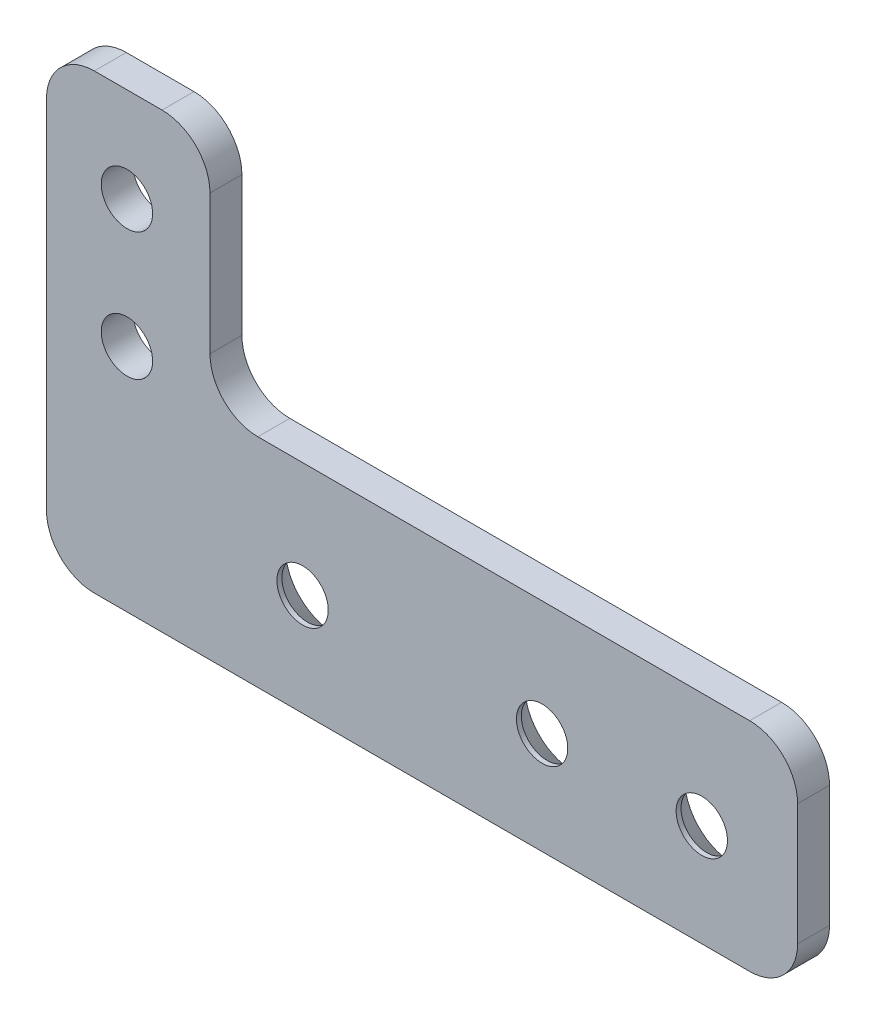
from build123d import *

# Parameters (mm, degrees)
SKETCH1_R                                    = 2.5527
BOSS_EXTRUDE1_DEPTH                          = 3.175
FILLET1_R                                    = 4.7625
CSK_FOR_10_FLAT_HEAD_MACHINE_SCREW3_AT_COUNT = 2
CSK_FOR_10_FLAT_HEAD_MACHINE_SCREW3_AT_PITCH = 15.875
CSK_FOR_10_FLAT_HEAD_MACHINE_SCREW3_2_COUNT  = 2
CSK_FOR_10_FLAT_HEAD_MACHINE_SCREW3_2_PITCH  = 39.6875


with BuildPart() as part:
    # Sketch1 → Boss-Extrude1 (new body)
    with BuildSketch(Plane.XY):
        Polygon((-33.401, 23.749), (-33.401, -21.209), (41.275, -21.209), (41.275, 0.381), (-17.145, 0.381), (-17.145, 23.749), align=None)
        with Locations((-25.4, 1.651)):
            Circle(SKETCH1_R, mode=Mode.SUBTRACT)
        with Locations((-25.4, 14.351)):
            Circle(SKETCH1_R, mode=Mode.SUBTRACT)
    extrude(amount=BOSS_EXTRUDE1_DEPTH)

    # Fillet1
    fillet1_edges = [part.edges().sort_by_distance(p)[0] for p in [
        (-33.401, 23.749, 1.5875),
        (-17.145, 23.749, 1.5875),
        (-17.145, 0.381, 1.5875),
        (41.275, 0.381, 1.5875),
        (41.275, -21.209, 1.5875),
        (-33.401, -21.209, 1.5875),
    ]]
    fillet(fillet1_edges, radius=FILLET1_R)

    # Sketch7 → CSK for #10 Flat Head Machine Screw3 (revolve, cut)
    with BuildSketch(Plane(origin=(31.75, -11.049, 0), x_dir=(0, 1, 0), z_dir=(1, 0, 0))):
        Polygon((0, 0), (0, 3.175), (2.5527, 3.175), (2.5527, 2.688180894), (4.8895, 0), align=None)
    csk_for_10_flat_head_machine_screw3 = revolve(axis=Axis((31.75, -11.049, -6.35), (0, 0, 1)), mode=Mode.SUBTRACT)

    # CSK for #10 Flat Head Machine Screw3 at: CSK for #10 Flat Head Machine Screw3 ×2
    with Locations(*[(-i * CSK_FOR_10_FLAT_HEAD_MACHINE_SCREW3_AT_PITCH, 0, 0) for i in range(1, CSK_FOR_10_FLAT_HEAD_MACHINE_SCREW3_AT_COUNT)]):
        add(csk_for_10_flat_head_machine_screw3, mode=Mode.SUBTRACT)

    # CSK for _10 Flat Head Machine Screw3 2: CSK for #10 Flat Head Machine Screw3 ×2
    with Locations(*[(-i * CSK_FOR_10_FLAT_HEAD_MACHINE_SCREW3_2_PITCH, 0, 0) for i in range(1, CSK_FOR_10_FLAT_HEAD_MACHINE_SCREW3_2_COUNT)]):
        add(csk_for_10_flat_head_machine_screw3, mode=Mode.SUBTRACT)


solid = part.part
